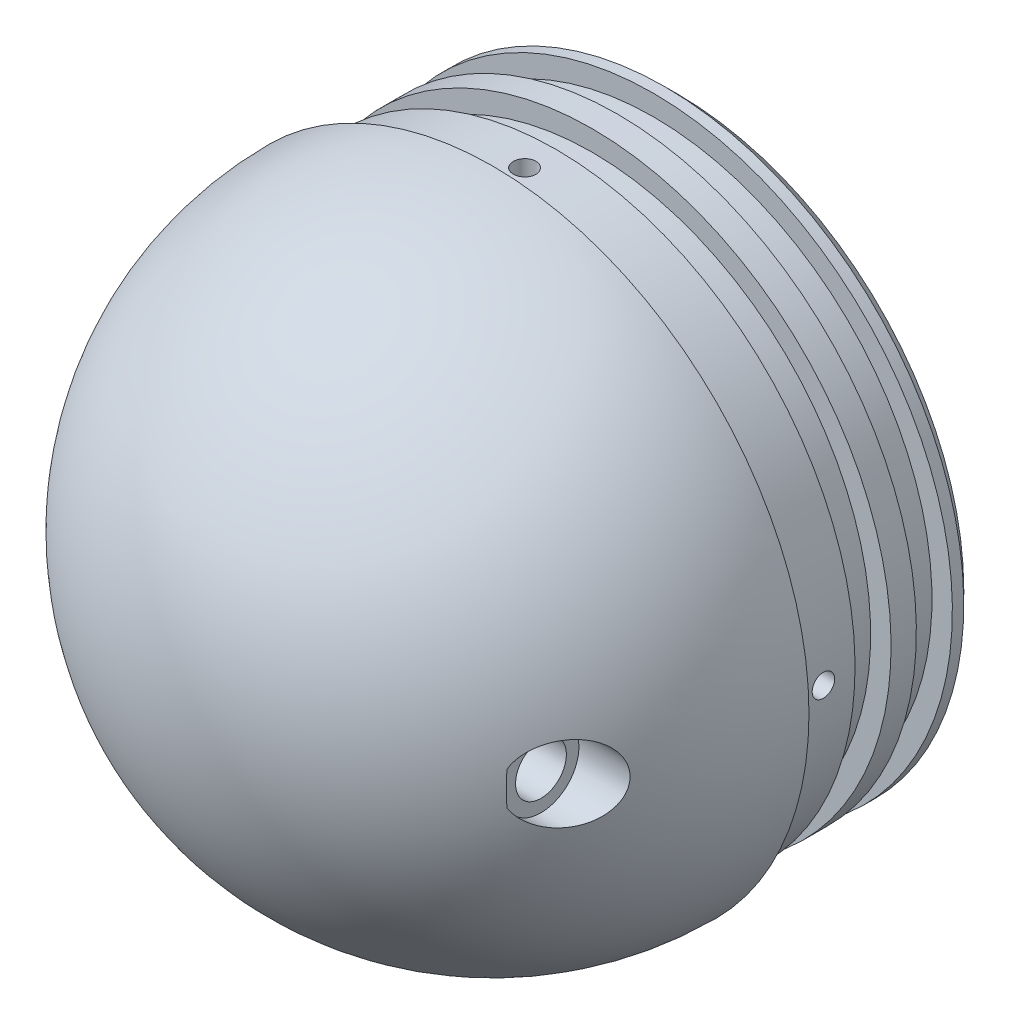
from build123d import *
from build123d.topology import SkipClean

# Parameters (mm, degrees)
F_4_40_TAPPED_HOLE1_D               = 2.2606
F_4_40_TAPPED_HOLE1_DEPTH           = 7.62
F_4_40_TAPPED_HOLE1_TIP             = 0.679152758
F_4_40_TAPPED_HOLE1_ON_FACE_2_D     = 2.2606
F_4_40_TAPPED_HOLE1_ON_FACE_2_DEPTH = 7.62
F_4_40_TAPPED_HOLE1_ON_FACE_2_TIP   = 0.679152758
F_4_40_TAPPED_HOLE1_ON_FACE_3_D     = 2.2606
F_4_40_TAPPED_HOLE1_ON_FACE_3_DEPTH = 7.62
F_4_40_TAPPED_HOLE1_ON_FACE_3_TIP   = 0.679152758
F_4_40_TAPPED_HOLE1_ON_FACE_4_D     = 2.2606
F_4_40_TAPPED_HOLE1_ON_FACE_4_DEPTH = 7.62
F_4_40_TAPPED_HOLE1_ON_FACE_4_TIP   = 0.679152758
SKETCH10_R                          = 20.50415
CUT_EXTRUDE3_DEPTH                  = 31.75
F_4_40_TAPPED_HOLE2_D               = 2.2606
F_4_40_TAPPED_HOLE2_DEPTH           = 7.62
F_4_40_TAPPED_HOLE2_TIP             = 0.679152758
CHAMFER1_SIZE                       = 1.27
SKETCH23_R                          = 26.9621
CUT_EXTRUDE6_DEPTH                  = 10
CUT_EXTRUDE7_DEPTH                  = 21.75
FILLET2_R                           = 3.556


# Read off the part's stored shape, not the designer's step: AdvancedHole3
with BuildPart() as part:
    # Sketch2 → Revolve1 (revolve)
    with BuildSketch(Plane(origin=(0, 0, 0), x_dir=(0, 0, -1), z_dir=(1, 0, 0))):
        Polygon((-18.542, 30.02915), (-12.192, 30.02915), (-12.192, 27.9781), (-8.5725, 27.9781), (-8.5725, 30.02915), (-6.0325, 30.02915), (-6.0325, 27.9781), (-2.413, 27.9781), (-2.413, 30.02915), (0, 30.02915), (0, 0), (-18.542, 0), align=None)
    revolve(axis=Axis((0, 0, 0), (0, 0, 1)))

    # #4-40 Tapped Hole1
    with Locations(Plane(origin=(0, -30.02915, 15.367), x_dir=(0, 0, -1), z_dir=(0, -1, 0))):
        with Locations((0, 0)):
            Hole(F_4_40_TAPPED_HOLE1_D / 2, depth=F_4_40_TAPPED_HOLE1_DEPTH)
            with Locations((0, 0, -(F_4_40_TAPPED_HOLE1_DEPTH + F_4_40_TAPPED_HOLE1_TIP / 2))):  # 118° drill point
                Cone(0, F_4_40_TAPPED_HOLE1_D / 2, F_4_40_TAPPED_HOLE1_TIP, mode=Mode.SUBTRACT)

    # #4-40 Tapped Hole1 on face 2
    with Locations(Plane(origin=(30.02915, 0, 15.367), x_dir=(0, 0, 1), z_dir=(1, 0, 0))):
        with Locations((0, 0)):
            Hole(F_4_40_TAPPED_HOLE1_ON_FACE_2_D / 2, depth=F_4_40_TAPPED_HOLE1_ON_FACE_2_DEPTH)
            with Locations((0, 0, -(F_4_40_TAPPED_HOLE1_ON_FACE_2_DEPTH + F_4_40_TAPPED_HOLE1_ON_FACE_2_TIP / 2))):  # 118° drill point
                Cone(0, F_4_40_TAPPED_HOLE1_ON_FACE_2_D / 2, F_4_40_TAPPED_HOLE1_ON_FACE_2_TIP, mode=Mode.SUBTRACT)

    # #4-40 Tapped Hole1 on face 3
    with Locations(Plane(origin=(-30.02915, 0, 15.367), x_dir=(0, 0, -1), z_dir=(-1, 0, 0))):
        with Locations((0, 0)):
            Hole(F_4_40_TAPPED_HOLE1_ON_FACE_3_D / 2, depth=F_4_40_TAPPED_HOLE1_ON_FACE_3_DEPTH)
            with Locations((0, 0, -(F_4_40_TAPPED_HOLE1_ON_FACE_3_DEPTH + F_4_40_TAPPED_HOLE1_ON_FACE_3_TIP / 2))):  # 118° drill point
                Cone(0, F_4_40_TAPPED_HOLE1_ON_FACE_3_D / 2, F_4_40_TAPPED_HOLE1_ON_FACE_3_TIP, mode=Mode.SUBTRACT)

    # #4-40 Tapped Hole1 on face 4
    with Locations(Plane(origin=(0, 30.02915, 15.367), x_dir=(0, 0, 1), z_dir=(0, 1, 0))):
        with Locations((0, 0)):
            Hole(F_4_40_TAPPED_HOLE1_ON_FACE_4_D / 2, depth=F_4_40_TAPPED_HOLE1_ON_FACE_4_DEPTH)
            with Locations((0, 0, -(F_4_40_TAPPED_HOLE1_ON_FACE_4_DEPTH + F_4_40_TAPPED_HOLE1_ON_FACE_4_TIP / 2))):  # 118° drill point
                Cone(0, F_4_40_TAPPED_HOLE1_ON_FACE_4_D / 2, F_4_40_TAPPED_HOLE1_ON_FACE_4_TIP, mode=Mode.SUBTRACT)

    # Sketch6 → Revolve2 (revolve)
    with BuildSketch(Plane(origin=(0, 0, 0), x_dir=(1, 0, 0), z_dir=(0, 1, 0)), mode=Mode.PRIVATE) as revolve2_sk:
        with BuildLine():
            Line((0, -18.542), (31.75, -18.542))
            ThreePointArc((31.75, -18.542), (22.450640303, -40.992640303), (0, -50.292))
            Line((0, -50.292), (0, -18.542))
        make_face()
    revolve(revolve2_sk.sketch.rotate(Axis((0, 0, 18.542), (0, 0, 1)), 90), axis=Axis((0, 0, 18.542), (0, 0, 1)))

    # Sketch10 → Cut-Extrude3 (cut)
    with BuildSketch(Plane(origin=(0, 0, 0), x_dir=(-1, 0, 0), z_dir=(0, 0, -1))):
        with Locations(Location((0, 0, 0), (0, 0, 90))):
            Circle(SKETCH10_R)
    extrude(amount=-CUT_EXTRUDE3_DEPTH, mode=Mode.SUBTRACT)

    # #4-40 Tapped Hole2
    with Locations(Plane(origin=(0, 0, 31.75), x_dir=(-1, 0, 0), z_dir=(0, 0, -1))):
        with Locations((0, 0)):
            Hole(F_4_40_TAPPED_HOLE2_D / 2, depth=F_4_40_TAPPED_HOLE2_DEPTH)
            with Locations((0, 0, -(F_4_40_TAPPED_HOLE2_DEPTH + F_4_40_TAPPED_HOLE2_TIP / 2))):  # 118° drill point
                Cone(0, F_4_40_TAPPED_HOLE2_D / 2, F_4_40_TAPPED_HOLE2_TIP, mode=Mode.SUBTRACT)

    # Chamfer1
    chamfer1_edges = [part.edges().sort_by_distance(p)[0] for p in [
        (0, -30.02915, 0),
    ]]
    chamfer(chamfer1_edges, length=CHAMFER1_SIZE)

    # AdvancedHole3 outline → AdvancedHole3 (revolve, cut)
    with BuildSketch(Plane.YX.offset(-36.83)):
        Polygon((3.81, 28.256858344), (0, 28.256858344), (0, 8.880183098), (2.5527, 10.414), (2.5527, 23.114), (3.81, 23.114), align=None)
    advancedhole3 = revolve(axis=Axis((0, 0, 36.83), (1, 0, 0)), mode=Mode.SUBTRACT)

    # Mirror2: AdvancedHole3 across plane
    add(advancedhole3.mirror(Plane(origin=(0, 0, 0), x_dir=(0, 0, 1), z_dir=(1, 0, 0))), mode=Mode.SUBTRACT)

    # Sketch23 → Cut-Extrude6 (cut)
    with BuildSketch(Plane(origin=(0, 0, 0), x_dir=(-1, 0, 0), z_dir=(0, 0, -1))):
        with Locations(Location((0, 0, 0), (0, 0, 90))):
            Circle(SKETCH23_R)
    extrude(amount=-CUT_EXTRUDE6_DEPTH, mode=Mode.SUBTRACT)

    # Sketch24 → Cut-Extrude7 (cut)
    with SkipClean():  # the faces are left unmerged after this step: merging them gives an invalid solid
        with BuildSketch(Plane(origin=(0, 0, 10), x_dir=(-1, 0, 0), z_dir=(0, 0, -1))):
            with BuildLine():
                Line((-5.972908248, 26.29218902), (-2.54, 20.346217516))
                Line((-2.54, 20.346217516), (2.54, 20.346217516))
                Line((2.54, 20.346217516), (5.972908248, 26.29218902))
                ThreePointArc((5.972908248, 26.29218902), (19.065083745, 19.065083745), (26.29218902, 5.972908248))
                Line((26.29218902, 5.972908248), (20.346217516, 2.54))
                Line((20.346217516, 2.54), (20.346217516, -2.54))
                Line((20.346217516, -2.54), (26.29218902, -5.972908248))
                ThreePointArc((26.29218902, -5.972908248), (19.065083745, -19.065083745), (5.972908248, -26.29218902))
                Line((5.972908248, -26.29218902), (2.54, -20.346217516))
                Line((2.54, -20.346217516), (-2.54, -20.346217516))
                Line((-2.54, -20.346217516), (-5.972908248, -26.29218902))
                ThreePointArc((-5.972908248, -26.29218902), (-19.065083745, -19.065083745), (-26.29218902, -5.972908248))
                Line((-26.29218902, -5.972908248), (-20.346217516, -2.54))
                Line((-20.346217516, -2.54), (-20.346217516, 2.54))
                Line((-20.346217516, 2.54), (-26.29218902, 5.972908248))
                ThreePointArc((-26.29218902, 5.972908248), (-19.065083745, 19.065083745), (-5.972908248, 26.29218902))
            make_face()
        extrude(amount=-CUT_EXTRUDE7_DEPTH, mode=Mode.SUBTRACT)

    # Fillet2
    fillet2_edges = [part.edges().sort_by_distance(p)[0] for p in [
        (26.29218902, 5.972908248, 20.875),
        (5.972908248, 26.29218902, 20.875),
        (-5.972908248, 26.29218902, 20.875),
        (-26.29218902, 5.972908248, 20.875),
        (-26.29218902, -5.972908248, 20.875),
        (-5.972908248, -26.29218902, 20.875),
        (5.972908248, -26.29218902, 20.875),
        (26.29218902, -5.972908248, 20.875),
    ]]
    fillet(fillet2_edges, radius=FILLET2_R)


solid = part.part
